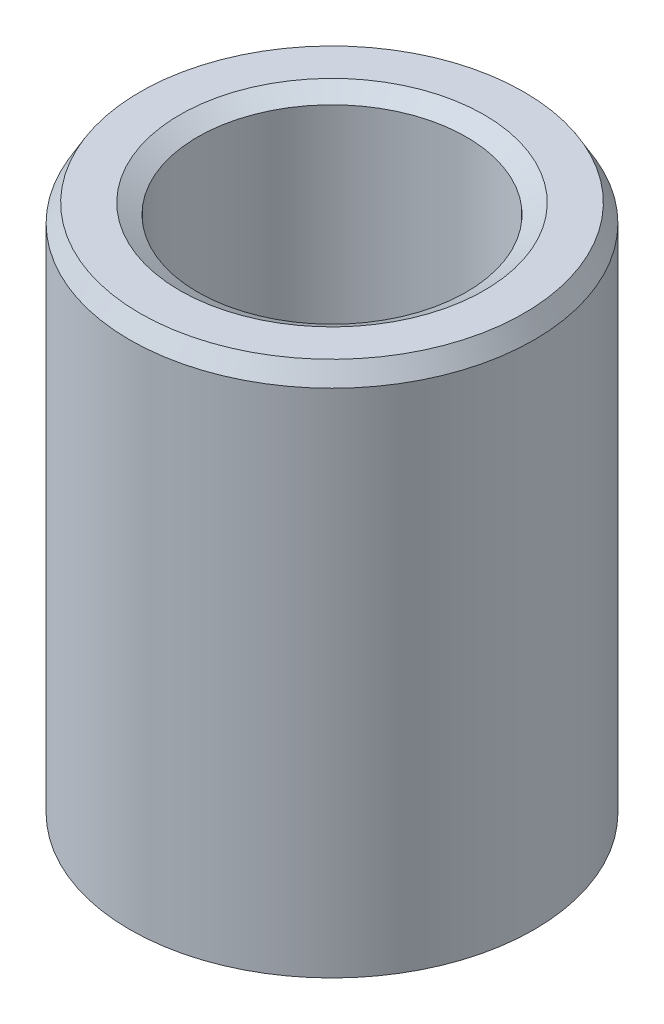
from build123d import *
from OCP.BRepFilletAPI import BRepFilletAPI_MakeChamfer

# Parameters (mm, degrees)
SKETCH1_R           = 10
BOSS_EXTRUDE1_DEPTH = 26.651429958
SKETCH2_R           = 6.647843734
CUT_EXTRUDE1_DEPTH  = 31.171157068
CHAMFER1_SIZE       = 0.880932997
CHAMFER1_SIZE2      = 0.508606903


with BuildPart() as part:
    # Sketch1 → Boss-Extrude1 (new body)
    with BuildSketch(Plane(origin=(0, 0, 0), x_dir=(1, 0, 0), z_dir=(0, 1, 0))):
        Circle(SKETCH1_R)
    extrude(amount=BOSS_EXTRUDE1_DEPTH)

    # Sketch2 → Cut-Extrude1 (cut, through all)
    with BuildSketch(Plane(origin=(0, 0, 0), x_dir=(1, 0, 0), z_dir=(0, 1, 0))):
        Circle(SKETCH2_R)
    extrude(amount=CUT_EXTRUDE1_DEPTH, mode=Mode.SUBTRACT)

    # Chamfer1: one chamfer whose edges measure the first distance from different faces: ONE call of the kernel's chamfer builder (chamfer() names one face for all edges)
    chamfer1_edges_1 = [part.edges().sort_by_distance(p)[0] for p in [
        (-6.647843734, 26.651429958, 0),
    ]]
    chamfer1_side_1 = [part.faces().sort_by_distance(p)[0] for p in [
        (-9.717157288, 26.651429958, 0),
    ]]
    chamfer1_edges_2 = [part.edges().sort_by_distance(p)[0] for p in [
        (-6.647843734, 0, 0),
    ]]
    chamfer1_side_2 = [part.faces().sort_by_distance(p)[0] for p in [
        (-6.647843734, 13.325714979, 0),
    ]]
    chamfer1_edges_3 = [part.edges().sort_by_distance(p)[0] for p in [
        (-10, 0, 0),
    ]]
    chamfer1_side_3 = [part.faces().sort_by_distance(p)[0] for p in [
        (-9.717157288, 0, 0),
    ]]
    chamfer1_edges_4 = [part.edges().sort_by_distance(p)[0] for p in [
        (-10, 26.651429958, 0),
    ]]
    chamfer1_side_4 = [part.faces().sort_by_distance(p)[0] for p in [
        (-10, 13.325714979, 0),
    ]]
    chamfer1 = BRepFilletAPI_MakeChamfer(part.part.solid().wrapped)
    for e in chamfer1_edges_1:
        chamfer1.Add(CHAMFER1_SIZE, CHAMFER1_SIZE2, e.wrapped, chamfer1_side_1[0].wrapped)  # the first distance lies on this face
    for e in chamfer1_edges_2:
        chamfer1.Add(CHAMFER1_SIZE, CHAMFER1_SIZE2, e.wrapped, chamfer1_side_2[0].wrapped)  # the first distance lies on this face
    for e in chamfer1_edges_3:
        chamfer1.Add(CHAMFER1_SIZE, CHAMFER1_SIZE2, e.wrapped, chamfer1_side_3[0].wrapped)  # the first distance lies on this face
    for e in chamfer1_edges_4:
        chamfer1.Add(CHAMFER1_SIZE, CHAMFER1_SIZE2, e.wrapped, chamfer1_side_4[0].wrapped)  # the first distance lies on this face
    add(Compound.cast(chamfer1.Shape()), mode=Mode.REPLACE)


solid = part.part
